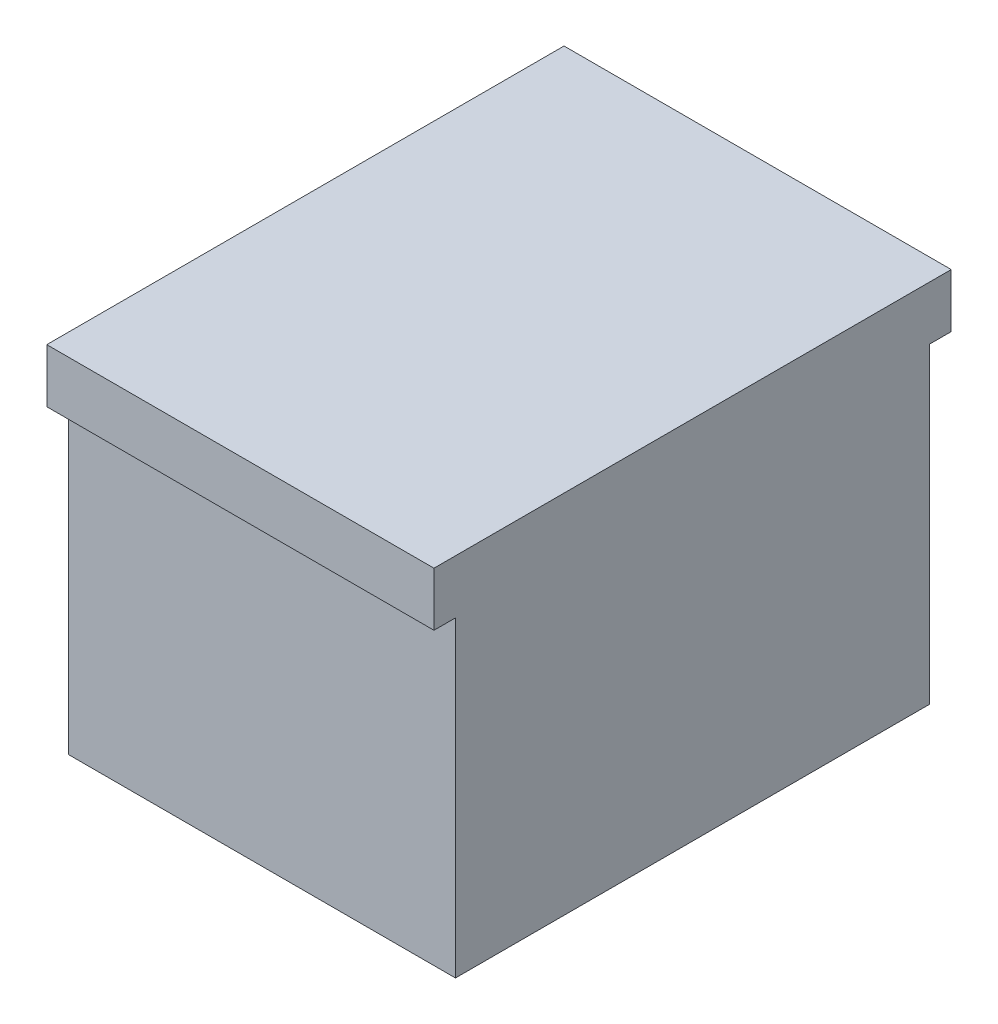
from build123d import *

# Parameters (mm, degrees)
SKETCH1_W                = 228.6
SKETCH1_H                = 280
BOSS_EXTRUDE1_DEPTH      = 215.9
M5_CLEARANCE_HOLE1_D     = 5.5
M5_CLEARANCE_HOLE1_DEPTH = 40
M5_CLEARANCE_HOLE1_TIP   = 1.652366702
SKETCH4_R                = 7.3787
SKETCH4_R_2              = 2.75
BOSS_EXTRUDE2_DEPTH      = 10.5918
SKETCH5_W                = 228.6
SKETCH5_H                = 305.4
BOSS_EXTRUDE3_DEPTH      = 31.75


with BuildPart() as part:
    # Sketch1 → Boss-Extrude1 (new body)
    with BuildSketch(Plane(origin=(0, 0, 0), x_dir=(1, 0, 0), z_dir=(0, 1, 0))):
        Rectangle(SKETCH1_W, SKETCH1_H)
    extrude(amount=BOSS_EXTRUDE1_DEPTH)

    # M5 Clearance Hole1
    with Locations(Plane(origin=(0, 0, 0), x_dir=(-1, 0, 0), z_dir=(0, -1, 0))):
        with Locations((-76.2, 0), (57.683542155, 75.946), (57.683542155, -75.946)):
            Hole(M5_CLEARANCE_HOLE1_D / 2, depth=M5_CLEARANCE_HOLE1_DEPTH)
            with Locations((0, 0, -(M5_CLEARANCE_HOLE1_DEPTH + M5_CLEARANCE_HOLE1_TIP / 2))):  # 118° drill point
                Cone(0, M5_CLEARANCE_HOLE1_D / 2, M5_CLEARANCE_HOLE1_TIP, mode=Mode.SUBTRACT)

    # Sketch4 → Boss-Extrude2 (add)
    # profile 1 of 2: a face of its own
    with BuildSketch(Plane.XZ):
        with Locations((-57.683542155, -75.946)):
            Circle(SKETCH4_R)
        with Locations((-57.683542155, -75.946)):
            Circle(SKETCH4_R_2, mode=Mode.SUBTRACT)
    # profile 2 of 2: a face of its own
    with BuildSketch(Plane.XZ):
        with Locations((-57.683542155, 75.946)):
            Circle(SKETCH4_R)
        with Locations((-57.683542155, 75.946)):
            Circle(SKETCH4_R_2, mode=Mode.SUBTRACT)
    extrude(amount=BOSS_EXTRUDE2_DEPTH)

    # Sketch5 → Boss-Extrude3 (add)
    with BuildSketch(Plane(origin=(0, 215.9, 0), x_dir=(1, 0, 0), z_dir=(0, 1, 0))):
        Rectangle(SKETCH5_W, SKETCH5_H)
    extrude(amount=-BOSS_EXTRUDE3_DEPTH)


solid = part.part
